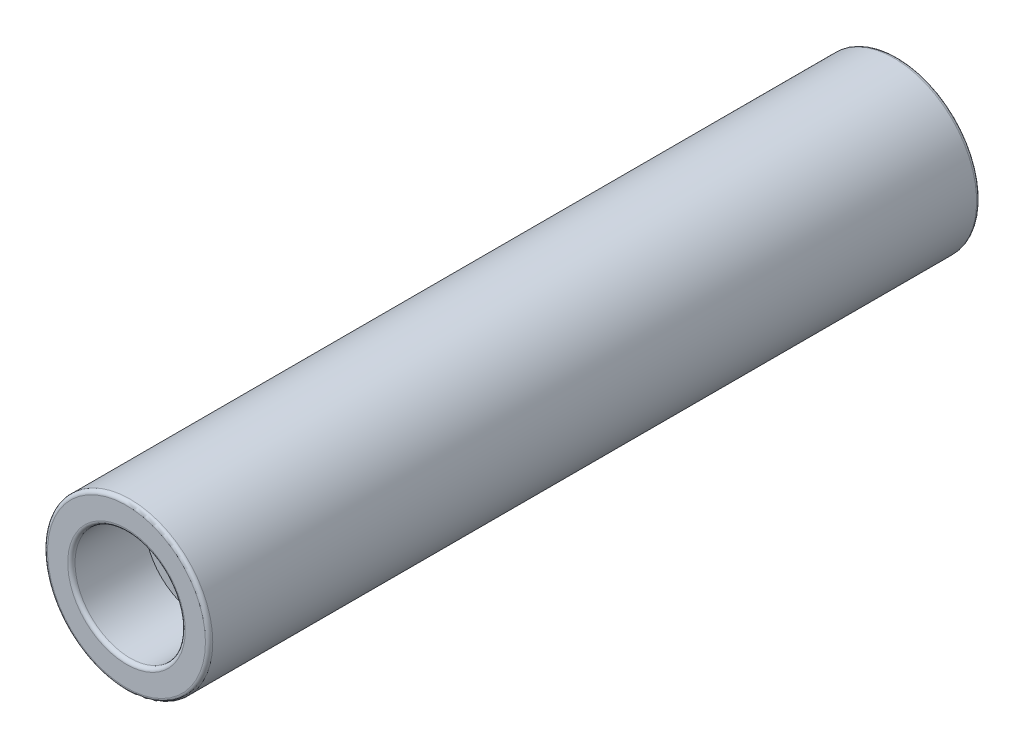
from build123d import *

# Parameters (mm, degrees)
SKETCH1_R           = 4.5
SKETCH1_R_2         = 4
EXTRUDE_THIN1_DEPTH = 12
SKETCH11_R          = 4.5
SKETCH11_R_2        = 1.5
EXTRUDE_THIN3_DEPTH = 5
SKETCH12_R          = 4.5
SKETCH12_R_2        = 3
EXTRUDE_THIN4_DEPTH = 4
THREAD1_PITCH       = 0.5
FILLET2_R           = 0.2


# Read off the part's stored shape, not the designer's step: Revolve1
with BuildPart() as part:
    # Sketch1 → Extrude-Thin1 (new body)
    with BuildSketch(Plane.XY):
        Circle(SKETCH1_R)
        Circle(SKETCH1_R_2, mode=Mode.SUBTRACT)
    extrude_thin1 = extrude(amount=EXTRUDE_THIN1_DEPTH)

    # Sketch11 → Extrude-Thin3 (add)
    with BuildSketch(Plane.XY.offset(12)):
        Circle(SKETCH11_R)
        Circle(SKETCH11_R_2, mode=Mode.SUBTRACT)
    extrude_thin3 = extrude(amount=EXTRUDE_THIN3_DEPTH)

    # Sketch12 → Extrude-Thin4 (add)
    with BuildSketch(Plane.XY.offset(17)):
        Circle(SKETCH12_R)
        Circle(SKETCH12_R_2, mode=Mode.SUBTRACT)
    extrude_thin4 = extrude(amount=EXTRUDE_THIN4_DEPTH)

    # Thread1: the profile of Thread Profile1 profile screwed along a right-hand helix of 10 turns, 6 arcs to a turn; built about Z, then put on its axis
    thread1_z = Axis((0, 0, 0), (0, 0, 1))
    thread1_corners = [(1.5003, 0, -0.000173205), (1.5003, 0, 0.437673204), (1.229367063, 0, 0.281249999), (1.229367063, 0, 0.156249999)]
    with BuildLine(mode=Mode.PRIVATE) as thread1_profile:
        Line(thread1_corners[0], thread1_corners[1])
        Line(thread1_corners[1], thread1_corners[2])
        Line(thread1_corners[2], thread1_corners[3])
        Line(thread1_corners[3], thread1_corners[0])
    thread1_cap = Face(thread1_profile.wire())
    thread1_turn_angles = [0, 30, 60, 90, 120, 150, 180, 210, 240, 270, 300, 330, 360]
    thread1_turn_weights = [1, 0.8660254037844387, 1, 0.8660254037844387, 1, 0.8660254037844387, 1, 0.8660254037844387, 1, 0.8660254037844387, 1, 0.8660254037844387, 1]
    thread1_turn_rails = [Edge.make_bspline([Vector(p[0], p[1], 0).rotate(thread1_z, thread1_turn_angles[k]) / thread1_turn_weights[k] + Vector(0, 0, p[2] + THREAD1_PITCH * thread1_turn_angles[k] / 360) for k in range(13)], [0, 0, 0, 1, 1, 2, 2, 3, 3, 4, 4, 5, 5, 6, 6, 6], 2, thread1_turn_weights) for p in thread1_corners]
    thread1_turn_sides = [Face.make_surface_from_curves(thread1_turn_rails[p[0]], thread1_turn_rails[p[1]]) for p in [(0, 1), (1, 2), (2, 3), (3, 0)]]
    thread1 = Plane(origin=(0, 0, 12), x_dir=(1, 0, 0), z_dir=(0, 0, 1)) * Solid(Shell([*[p.moved(Location((0, 0, THREAD1_PITCH * i))) for i in range(10) for p in thread1_turn_sides], thread1_cap, thread1_cap.rotate(thread1_z, 3600).moved(Location((0, 0, THREAD1_PITCH * 3600 / 360)))]))
    add(thread1)

    # Mirror2: Extrude-Thin1, Extrude-Thin3, Extrude-Thin4, Thread1 across plane
    add(extrude_thin1.mirror(Plane.XY))
    add(extrude_thin3.mirror(Plane.XY))
    add(extrude_thin4.mirror(Plane.XY))
    add(thread1.mirror(Plane.XY))

    # Fillet2
    fillet2_edges = [part.edges().sort_by_distance(p)[0] for p in [
        (-4.5, 0, 21),
        (-3, 0, 21),
        (-4.5, 0, -21),
        (-3, 0, -21),
    ]]
    fillet(fillet2_edges, radius=FILLET2_R)

    # Revolve1 outline → Revolve1 (revolve)
    with BuildSketch(Plane.XZ):
        Polygon((4, 12), (1.5, 12), (4, 9.5), align=None)
    revolve1 = revolve(axis=Axis((0, 0, 0), (0, 0, 1)))

    # Mirror3: Revolve1 across plane
    add(revolve1.mirror(Plane.XY))


solid = part.part
